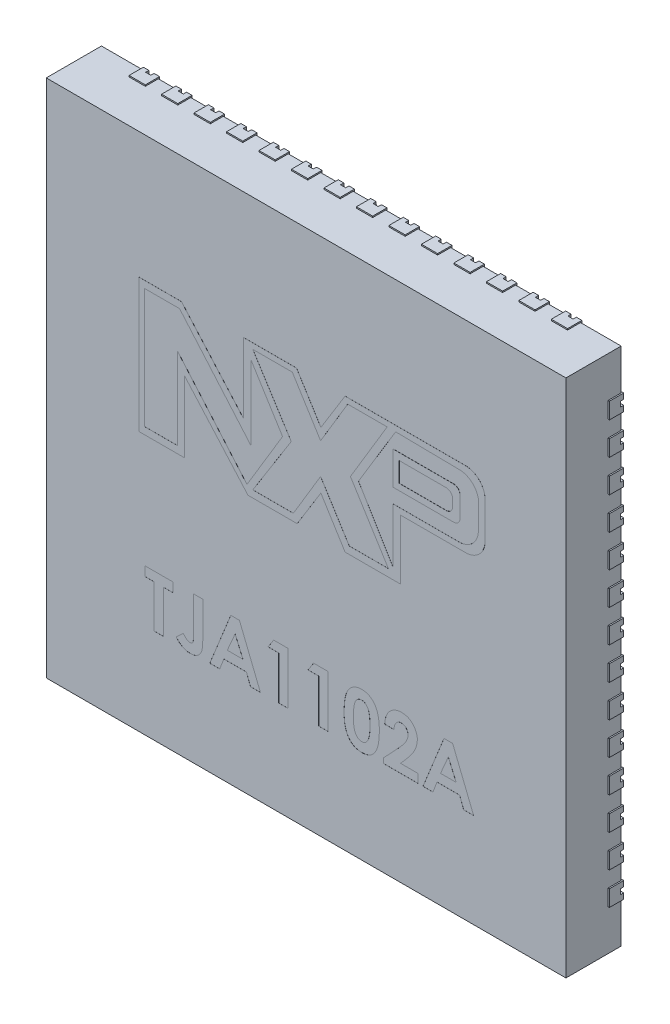
from build123d import *

# Parameters (mm, degrees)
SKETCH1_W            = 8
SKETCH1_H            = 8
BOSS_EXTRUDE1_DEPTH  = 0.85
BOSS_EXTRUDE2_DEPTH  = 0.001
CUT_EXTRUDE3_DEPTH   = 0.001
BOSS_EXTRUDE3_DEPTH  = 0.002
SKETCH17_W           = 0.102885944
SKETCH17_H           = 0.053280221
BOSS_EXTRUDE7_DEPTH  = 0.01
SKETCH18_W           = 0.053280221
SKETCH18_H           = 0.097122664
BOSS_EXTRUDE8_DEPTH  = 0.01
BOSS_EXTRUDE11_DEPTH = 0.02
BOSS_EXTRUDE12_DEPTH = 0.02
SKETCH20_W           = 11.066170871
SKETCH20_H           = 10.53323913
SKETCH20_W_2         = 8
SKETCH20_H_2         = 8
CUT_EXTRUDE5_DEPTH   = 60.02
SKETCH21_W           = 0.25
SKETCH21_H           = 0.22
BOSS_EXTRUDE13_DEPTH = 0.02
SKETCH22_W           = 0.22
SKETCH22_H           = 0.25
BOSS_EXTRUDE14_DEPTH = 0.02
CUT_EXTRUDE6_DEPTH   = 30.02
CUT_EXTRUDE7_DEPTH   = 0.05


with BuildPart() as part:
    # Sketch1 → Boss-Extrude1 (new body)
    with BuildSketch(Plane.XY):
        Rectangle(SKETCH1_W, SKETCH1_H)
    extrude(amount=BOSS_EXTRUDE1_DEPTH)

    # Sketch6 → Boss-Extrude2 (add)
    # profile 1 of 2: a face of its own
    with BuildSketch(Plane.XY.offset(0.85)):
        with BuildLine():
            Line((-2.572181988, 2.05829911), (-2.572181988, 0))
            Line((-2.572181988, 0), (-1.873722746, 0))
            Line((-1.873722746, 0), (-1.873722746, 1.098138196))
            Line((-1.873722746, 1.098138196), (-0.893404452, -0.010470706))
            Line((-0.893404452, -0.010470706), (-0.136448746, -0.010470706))
            Line((-0.136448746, -0.010470706), (0.228352899, 0.580170445))
            Line((0.228352899, 0.580170445), (0.601301061, -0.02108393))
            Line((0.601301061, -0.02108393), (1.455438192, -0.02108393))
            Line((1.455438192, -0.02108393), (1.455438192, 0.898972256))
            Line((1.455438192, 0.898972256), (2.455877544, 0.898972256))
            ThreePointArc((2.455877544, 0.898972256), (2.668009579, 0.986840222), (2.755877544, 1.198972256))
            Line((2.755877544, 1.198972256), (2.755877544, 1.75829911))
            ThreePointArc((2.755877544, 1.75829911), (2.668009579, 1.970431144), (2.455877544, 2.05829911))
            Line((2.455877544, 2.05829911), (0.601301061, 2.05829911))
            Line((0.601301061, 2.05829911), (0.228352899, 1.454468139))
            Line((0.228352899, 1.454468139), (-0.146193482, 2.05829911))
            Line((-0.146193482, 2.05829911), (-0.961388027, 2.05829911))
            Line((-0.961388027, 2.05829911), (-0.961388027, 0.976628837))
            Line((-0.961388027, 0.976628837), (-1.917885089, 2.05829911))
            Line((-1.917885089, 2.05829911), (-2.572181988, 2.05829911))
        make_face()
        Polygon((-1.977820319, 0.108733586), (-2.48457273, 0.108733586), (-2.48457273, 1.950510846), (-1.946368831, 1.950510846), (-0.850193083, 0.677075779), (-0.850193083, 1.821787095), (-0.361090095, 1.03808165), (-0.90931464, 0.125763735), (-1.977820319, 1.367054288), align=None, mode=Mode.SUBTRACT)
        Polygon((-0.228028186, 1.03808165), (-0.819884632, 1.97186495), (-0.211226434, 1.97186495), (0.223964381, 1.275260469), (0.64158324, 1.97186495), (1.249142409, 1.97186495), (0.68349863, 1.028349151), (1.268436343, 0.092046687), (0.664861213, 0.092046687), (0.223964381, 0.797784718), (-0.195507956, 0.098088564), (-0.819884632, 0.098088564), align=None, mode=Mode.SUBTRACT)
        with BuildLine():
            Line((0.807662695, 1.028349151), (1.379139756, 1.97186495))
            Line((1.379139756, 1.97186495), (2.3627905, 1.958078515))
            ThreePointArc((2.3627905, 1.958078515), (2.573670302, 1.867246317), (2.658556778, 1.653903715))
            Line((2.658556778, 1.653903715), (2.653410242, 1.286702658))
            ThreePointArc((2.653410242, 1.286702658), (2.564080062, 1.077293625), (2.353439703, 0.990906918))
            Line((2.353439703, 0.990906918), (1.338814728, 0.990906918))
            Line((1.338814728, 0.990906918), (1.338814728, 0.147417795))
            Line((1.338814728, 0.147417795), (0.807662695, 1.028349151))
        make_face(mode=Mode.SUBTRACT)
    # profile 2 of 2: a face of its own
    with BuildSketch(Plane.XY.offset(0.85)):
        with BuildLine():
            Line((2.271489026, 1.723742839), (1.338814728, 1.723742839))
            Line((1.338814728, 1.723742839), (1.338814728, 1.214183628))
            Line((1.338814728, 1.214183628), (2.271489026, 1.214183628))
            ThreePointArc((2.271489026, 1.214183628), (2.342199704, 1.24347295), (2.371489026, 1.314183628))
            Line((2.371489026, 1.314183628), (2.371489026, 1.623742839))
            ThreePointArc((2.371489026, 1.623742839), (2.342199704, 1.694453517), (2.271489026, 1.723742839))
        make_face()
        with BuildLine():
            Line((1.434337958, 1.313216465), (1.434337958, 1.617059243))
            Line((1.434337958, 1.617059243), (2.158511115, 1.617059243))
            ThreePointArc((2.158511115, 1.617059243), (2.229221793, 1.587769921), (2.258511115, 1.517059243))
            Line((2.258511115, 1.517059243), (2.258511115, 1.413216465))
            ThreePointArc((2.258511115, 1.413216465), (2.229221793, 1.342505787), (2.158511115, 1.313216465))
            Line((2.158511115, 1.313216465), (1.434337958, 1.313216465))
        make_face(mode=Mode.SUBTRACT)
    extrude(amount=BOSS_EXTRUDE2_DEPTH)

    # Sketch8 → Cut-Extrude3 (cut)
    # profile 1 of 8: a face of its own
    with BuildSketch(Plane.XY.offset(0.85)):
        Polygon((-2.482523388, -1.744618851), (-2.051754157, -1.744618851), (-2.051754157, -1.888208594), (-2.1953439, -1.888208594), (-2.1953439, -2.544618851), (-2.338933644, -2.544618851), (-2.338933644, -1.888208594), (-2.482523388, -1.888208594), align=None)
    # profile 2 of 8: a face of its own
    with BuildSketch(Plane.XY.offset(0.85)):
        with BuildLine():
            Line((-1.733805439, -1.744618851), (-1.590215695, -1.744618851))
            Line((-1.590215695, -1.744618851), (-1.590215695, -2.275708594))
            add(Edge.make_bspline(
                [(-1.590215695, -2.275708594), (-1.59026834, -2.285859156), (-1.590369775, -2.305417283), (-1.591385321, -2.333573767), (-1.592758518, -2.35938906), (-1.594736055, -2.382821799), (-1.597673239, -2.40387085), (-1.600997239, -2.422588729), (-1.604664534, -2.439051705), (-1.610859495, -2.457476337), (-1.620476992, -2.477879521), (-1.63499007, -2.499917859), (-1.653063498, -2.519065419), (-1.673878116, -2.535697288), (-1.697609305, -2.548866583), (-1.723710351, -2.558385384), (-1.752097818, -2.564071982), (-1.771759709, -2.564771522), (-1.781882362, -2.565131671)],
                knots=[0, 0, 0, 0, 1.22248561, 2.355488409, 3.392943897, 4.335991845, 5.186735882, 5.951517034, 6.625683685, 7.215700098, 8.28923535, 9.333114649, 10.380102123, 11.447198135, 12.530158036, 13.633358744, 14.781567393, 16, 16, 16, 16], degree=3))
            add(Edge.make_bspline(
                [(-1.781882362, -2.565131671), (-1.792429245, -2.564805152), (-1.813231818, -2.564161128), (-1.843740933, -2.5586757), (-1.873064006, -2.549880908), (-1.901049336, -2.537164694), (-1.928080329, -2.521235919), (-1.953666399, -2.501477823), (-1.978341746, -2.478503192), (-1.992969442, -2.460873038), (-2.000472106, -2.451830389)],
                knots=[0, 0, 0, 0, 0.990984786, 1.954608977, 2.90473533, 3.862451285, 4.837525908, 5.848096122, 6.896271184, 8, 8, 8, 8], degree=3))
            Line((-2.000472106, -2.451830389), (-1.891818259, -2.35134962))
            add(Edge.make_bspline(
                [(-1.891818259, -2.35134962), (-1.886129267, -2.357782264), (-1.875483632, -2.369819471), (-1.859440974, -2.385516284), (-1.844969632, -2.398126861), (-1.831327947, -2.407222985), (-1.818454616, -2.413634736), (-1.80607266, -2.418253301), (-1.793796116, -2.420867671), (-1.785685857, -2.421320577), (-1.781722106, -2.421541928)],
                knots=[0, 0, 0, 0, 1.529509877, 2.862124173, 3.996688592, 4.944357383, 5.774364335, 6.554177287, 7.293378699, 8, 8, 8, 8], degree=3))
            add(Edge.make_bspline(
                [(-1.781722106, -2.421541928), (-1.777885635, -2.421341862), (-1.770509364, -2.420957201), (-1.760366709, -2.416681211), (-1.751815798, -2.409967725), (-1.746186383, -2.402249703), (-1.742598955, -2.394359806), (-1.740357463, -2.386733008), (-1.738230283, -2.377590545), (-1.736526034, -2.366936997), (-1.7352383, -2.354633405), (-1.734596458, -2.340829134), (-1.733815895, -2.325449586), (-1.733809048, -2.314705638), (-1.733805439, -2.309041928)],
                knots=[0, 0, 0, 0, 1.003927327, 1.930222208, 2.840933547, 3.835773585, 4.407906147, 5.114514582, 5.922289074, 6.876303333, 7.950072246, 9.174518422, 10.510537432, 12, 12, 12, 12], degree=3))
            Line((-1.733805439, -2.309041928), (-1.733805439, -1.744618851))
        make_face()
    # profile 3 of 8: a face of its own
    with BuildSketch(Plane.XY.offset(0.85)):
        Polygon((-1.159286208, -1.744618851), (-1.026113131, -1.744618851), (-0.703036208, -2.544618851), (-0.856401593, -2.544618851), (-0.91858108, -2.380516287), (-1.267138772, -2.380516287), (-1.329318259, -2.544618851), (-1.482523388, -2.544618851), align=None)
        Polygon((-1.092779798, -1.959202184), (-1.212651593, -2.236926543), (-0.972908003, -2.236926543), align=None, mode=Mode.SUBTRACT)
    # profile 4 of 8: a face of its own
    with BuildSketch(Plane.XY.offset(0.85)):
        Polygon((-0.499350311, -1.744618851), (-0.277395182, -1.744618851), (-0.277395182, -2.544618851), (-0.420984926, -2.544618851), (-0.420984926, -1.877952184), (-0.58508749, -1.877952184), align=None)
    # profile 5 of 8: a face of its own
    with BuildSketch(Plane.XY.offset(0.85)):
        Polygon((0.116034305, -1.744618851), (0.337989433, -1.744618851), (0.337989433, -2.544618851), (0.194399689, -2.544618851), (0.194399689, -1.877952184), (0.030297125, -1.877952184), align=None)
    # profile 6 of 8: a face of its own
    with BuildSketch(Plane.XY.offset(0.85)):
        with BuildLine():
            add(Edge.make_bspline(
                [(0.853534305, -1.72410603), (0.860484644, -1.72420921), (0.874150869, -1.724412089), (0.894278645, -1.726609433), (0.913667259, -1.729929008), (0.93239256, -1.734558657), (0.950319763, -1.740685832), (0.967579345, -1.748019956), (0.983965867, -1.756945718), (0.99968831, -1.767027825), (1.014740618, -1.778442199), (1.028761018, -1.791455175), (1.042005553, -1.805767324), (1.054187528, -1.821595019), (1.065576716, -1.838794291), (1.076135694, -1.857367868), (1.085783631, -1.877406654), (1.094628657, -1.898946811), (1.102537907, -1.922311217), (1.109199858, -1.947767871), (1.114913596, -1.975322587), (1.119736394, -2.005043953), (1.12338165, -2.036971476), (1.125838626, -2.071083945), (1.127524719, -2.107315595), (1.127662326, -2.132170209), (1.127733023, -2.144939364)],
                knots=[0, 0, 0, 0, 0.879237366, 1.728815576, 2.559023295, 3.367336655, 4.166867292, 4.954216142, 5.737608147, 6.525189134, 7.316157332, 8.124696809, 8.942788509, 9.781158001, 10.649253743, 11.551476218, 12.482711956, 13.461909668, 14.496590415, 15.601789533, 16.789733467, 18.056700938, 19.410929216, 20.8549011, 22.384193279, 24, 24, 24, 24], degree=3))
            add(Edge.make_bspline(
                [(1.127733023, -2.144939364), (1.127656619, -2.157868274), (1.127508169, -2.182988916), (1.125908718, -2.219551959), (1.123154387, -2.253912105), (1.119604408, -2.286065797), (1.114741907, -2.315996058), (1.109047243, -2.343780385), (1.102280134, -2.369408707), (1.094110356, -2.392823279), (1.085318869, -2.414401266), (1.075644541, -2.434400981), (1.065255994, -2.452876595), (1.054391509, -2.470106838), (1.042455456, -2.485583772), (1.030028797, -2.499833692), (1.016570451, -2.512313801), (1.002647068, -2.523667268), (0.987748577, -2.533478942), (0.972028623, -2.54206007), (0.955206947, -2.549020384), (0.937590178, -2.555074094), (0.918878036, -2.559420004), (0.899367854, -2.562868341), (0.878839366, -2.564774103), (0.864862745, -2.565010526), (0.857700971, -2.565131671)],
                knots=[0, 0, 0, 0, 1.643780988, 3.193836972, 4.651895693, 6.025988579, 7.305620092, 8.505800249, 9.631074763, 10.672816429, 11.65661981, 12.592235626, 13.49536222, 14.350718032, 15.179365177, 15.97804903, 16.751647189, 17.51006938, 18.259804725, 19.016521909, 19.783502495, 20.571750527, 21.382245291, 22.22305063, 23.089471752, 24, 24, 24, 24], degree=3))
            add(Edge.make_bspline(
                [(0.857700971, -2.565131671), (0.850539391, -2.565008189), (0.836509961, -2.564766289), (0.815925962, -2.562882511), (0.796312386, -2.559406035), (0.777452201, -2.555040729), (0.759476671, -2.549033779), (0.742299604, -2.541865217), (0.726053077, -2.533337631), (0.710692105, -2.523503096), (0.696269136, -2.512225593), (0.682560036, -2.499625745), (0.669595131, -2.485735491), (0.657571649, -2.470399247), (0.646292681, -2.453821722), (0.635875848, -2.435813607), (0.62632741, -2.416401122), (0.61734869, -2.395557209), (0.60954732, -2.37283312), (0.602604462, -2.348025934), (0.596917056, -2.320928862), (0.592342863, -2.291550609), (0.58869083, -2.259953414), (0.585974138, -2.226122026), (0.584365803, -2.190040688), (0.584218909, -2.165240187), (0.584143279, -2.152471415)],
                knots=[0, 0, 0, 0, 0.917216111, 1.796812873, 2.643793957, 3.46689424, 4.273913431, 5.068098542, 5.848489301, 6.620921603, 7.401012384, 8.190319798, 9.003608147, 9.831726257, 10.68377682, 11.569763213, 12.493818149, 13.453288342, 14.474581811, 15.568529029, 16.750744269, 18.018426408, 19.375425659, 20.823733699, 22.36466933, 24, 24, 24, 24], degree=3))
            add(Edge.make_bspline(
                [(0.584143279, -2.152471415), (0.584280275, -2.134730211), (0.584544611, -2.100498331), (0.587894467, -2.051043216), (0.592811206, -2.005330529), (0.600032731, -1.963436737), (0.608962047, -1.925206676), (0.620396501, -1.890892186), (0.633413795, -1.86001845), (0.644506202, -1.841728663), (0.649848407, -1.832920133)],
                knots=[0, 0, 0, 0, 1.288568992, 2.486310467, 3.599230591, 4.627010532, 5.572937695, 6.447898582, 7.252493626, 8, 8, 8, 8], degree=3))
            add(Edge.make_bspline(
                [(0.649848407, -1.832920133), (0.656060069, -1.824266635), (0.668205093, -1.807347343), (0.689441006, -1.785135474), (0.71225623, -1.766138796), (0.737119376, -1.750787221), (0.763637223, -1.738680968), (0.792037441, -1.730130457), (0.822215152, -1.725148531), (0.84293869, -1.72445872), (0.853534305, -1.72410603)],
                knots=[0, 0, 0, 0, 1.058512271, 2.069600068, 3.047294572, 4.004278952, 4.967380941, 5.939006123, 6.946246673, 8, 8, 8, 8], degree=3))
        make_face()
        with BuildLine():
            add(Edge.make_bspline(
                [(0.857059946, -1.867695774), (0.850776781, -1.867993583), (0.838458443, -1.868577448), (0.820583948, -1.873533636), (0.803729415, -1.881188735), (0.790908622, -1.89040045), (0.781312386, -1.899230984), (0.774607427, -1.907222329), (0.768141551, -1.916140095), (0.762430563, -1.926386694), (0.7570379, -1.937593954), (0.751767643, -1.949812748), (0.747447416, -1.963343198), (0.743202908, -1.977954877), (0.739484322, -1.99405176), (0.736368963, -2.011765421), (0.733585663, -2.031211053), (0.731644278, -2.052401394), (0.729834325, -2.075314273), (0.728536865, -2.100000732), (0.727994429, -2.126454109), (0.727822006, -2.144672158), (0.727733023, -2.154073979)],
                knots=[0, 0, 0, 0, 1.076674018, 2.110852608, 3.161083442, 4.239746716, 4.804137807, 5.395870207, 6.026861976, 6.692161227, 7.405688833, 8.16177676, 8.973626916, 9.841385931, 10.773283133, 11.807421078, 12.927755683, 14.143907515, 15.458935494, 16.872852025, 18.386167141, 20, 20, 20, 20], degree=3))
            add(Edge.make_bspline(
                [(0.727733023, -2.154073979), (0.727879478, -2.166254493), (0.728160317, -2.18961153), (0.729631219, -2.223199764), (0.732579522, -2.253767762), (0.736246615, -2.281522693), (0.741397196, -2.306284561), (0.747323274, -2.328287635), (0.754641452, -2.347251429), (0.763099018, -2.363450203), (0.772466153, -2.377230466), (0.78263459, -2.388943752), (0.793258131, -2.399086905), (0.80466837, -2.407326064), (0.816838086, -2.413640175), (0.829665684, -2.418181837), (0.843159317, -2.420961977), (0.852399617, -2.421347493), (0.857059946, -2.421541928)],
                knots=[0, 0, 0, 0, 1.771748488, 3.397459088, 4.888034009, 6.237357457, 7.467047327, 8.564189669, 9.548206622, 10.417051504, 11.216568818, 11.965764335, 12.669334354, 13.348544111, 14.005342236, 14.656555988, 15.322436492, 16, 16, 16, 16], degree=3))
            add(Edge.make_bspline(
                [(0.857059946, -2.421541928), (0.861560347, -2.421408881), (0.870371572, -2.421148393), (0.883220311, -2.418474515), (0.895370992, -2.41412737), (0.906786928, -2.407978029), (0.917508952, -2.400158201), (0.927484662, -2.390633521), (0.936638822, -2.379309053), (0.941972077, -2.370904622), (0.944720202, -2.366573979)],
                knots=[0, 0, 0, 0, 0.992283464, 1.942767638, 2.88273346, 3.832339453, 4.79467288, 5.803907806, 6.868395428, 8, 8, 8, 8], degree=3))
            add(Edge.make_bspline(
                [(0.944720202, -2.366573979), (0.947955657, -2.360656293), (0.954740142, -2.348247386), (0.962591161, -2.327307818), (0.96919971, -2.303691446), (0.974887592, -2.277324774), (0.978777757, -2.248103808), (0.982127962, -2.216213842), (0.983743849, -2.181494289), (0.984006681, -2.157440457), (0.984143279, -2.144939364)],
                knots=[0, 0, 0, 0, 0.710965849, 1.490837728, 2.352621235, 3.297892224, 4.334225155, 5.461620853, 6.680770821, 8, 8, 8, 8], degree=3))
            add(Edge.make_bspline(
                [(0.984143279, -2.144939364), (0.984090514, -2.132329754), (0.983988951, -2.108058408), (0.982125562, -2.073214036), (0.979530651, -2.041389486), (0.975735044, -2.012655807), (0.970851306, -1.986943248), (0.964832081, -1.96425349), (0.957735863, -1.944541815), (0.949320593, -1.927827878), (0.940000159, -1.913623325), (0.930106234, -1.90143692), (0.919596982, -1.891032475), (0.908489978, -1.882370836), (0.896528147, -1.875752694), (0.883939975, -1.871079739), (0.870699655, -1.868252757), (0.861667883, -1.867883941), (0.857059946, -1.867695774)],
                knots=[0, 0, 0, 0, 1.793836731, 3.452829483, 4.963243077, 6.335886805, 7.574563692, 8.684454726, 9.672768357, 10.54971625, 11.340229787, 12.085688095, 12.778991901, 13.440269426, 14.083255152, 14.715733572, 15.344777694, 16, 16, 16, 16], degree=3))
        make_face(mode=Mode.SUBTRACT)
    # profile 7 of 8: a face of its own
    with BuildSketch(Plane.XY.offset(0.85)):
        with BuildLine():
            Line((1.353374048, -2.011285517), (1.209784305, -2.011285517))
            add(Edge.make_bspline(
                [(1.209784305, -2.011285517), (1.210404447, -2.000423713), (1.211616167, -1.979200399), (1.216436085, -1.948372856), (1.222894609, -1.919244218), (1.231514366, -1.89191638), (1.242345656, -1.866399272), (1.25510976, -1.842605905), (1.270132773, -1.820661551), (1.287094956, -1.800672038), (1.305708337, -1.782739262), (1.325586484, -1.766838937), (1.347033461, -1.753718388), (1.369657413, -1.742921391), (1.393454489, -1.734295092), (1.418649845, -1.728527713), (1.445025327, -1.724621988), (1.463081481, -1.724280221), (1.472284305, -1.72410603)],
                knots=[0, 0, 0, 0, 1.199038563, 2.342849363, 3.436047546, 4.486744587, 5.497670872, 6.488682221, 7.459191391, 8.424610317, 9.374430501, 10.305433194, 11.225809216, 12.140057399, 13.06607119, 14.010487599, 14.985989317, 16, 16, 16, 16], degree=3))
            add(Edge.make_bspline(
                [(1.472284305, -1.72410603), (1.483580641, -1.724458506), (1.505633736, -1.72514662), (1.537678632, -1.731016467), (1.567605061, -1.740834693), (1.59539127, -1.754553344), (1.620800709, -1.771981451), (1.643829166, -1.792761617), (1.663780222, -1.817329821), (1.680780373, -1.844663818), (1.694905467, -1.873606675), (1.704803745, -1.903534789), (1.711309776, -1.933653989), (1.712003685, -1.953934734), (1.712348407, -1.964009876)],
                knots=[0, 0, 0, 0, 1.075374347, 2.099382735, 3.09057751, 4.06680945, 5.040638231, 6.016817125, 7.011024321, 8.044445721, 9.0776792, 10.070479129, 11.0414456, 12, 12, 12, 12], degree=3))
            add(Edge.make_bspline(
                [(1.712348407, -1.964009876), (1.712214191, -1.970104035), (1.711944046, -1.98237007), (1.710065691, -2.000931591), (1.707247788, -2.019838671), (1.702999077, -2.039075098), (1.697700587, -2.058646264), (1.691272752, -2.07861074), (1.683566472, -2.098855334), (1.674710351, -2.119607895), (1.664144976, -2.140935799), (1.651843065, -2.16315876), (1.637478097, -2.186257063), (1.621223585, -2.21036113), (1.603000582, -2.235432944), (1.582720131, -2.261396983), (1.560615814, -2.288344733), (1.544927759, -2.306357792), (1.536867638, -2.31561244)],
                knots=[0, 0, 0, 0, 0.728284026, 1.46585585, 2.227944881, 3.01186502, 3.81876927, 4.650621989, 5.517437689, 6.406905708, 7.346299482, 8.360816762, 9.441613733, 10.596154504, 11.834900912, 13.145207542, 14.533280747, 16, 16, 16, 16], degree=3))
            Line((1.536867638, -2.31561244), (1.453374048, -2.411285517))
            Line((1.453374048, -2.411285517), (1.722604818, -2.411285517))
            Line((1.722604818, -2.411285517), (1.722604818, -2.544618851))
            Line((1.722604818, -2.544618851), (1.189271484, -2.544618851))
            Line((1.189271484, -2.544618851), (1.189271484, -2.47186244))
            Line((1.189271484, -2.47186244), (1.426130459, -2.219779107))
            add(Edge.make_bspline(
                [(1.426130459, -2.219779107), (1.432988135, -2.212425758), (1.446269419, -2.198184501), (1.465167319, -2.177269701), (1.482268248, -2.157422055), (1.497217606, -2.138430225), (1.510799916, -2.12091023), (1.522409543, -2.104333994), (1.532152707, -2.088851374), (1.542730293, -2.070182037), (1.552775523, -2.047915531), (1.561992629, -2.022263604), (1.567611093, -1.997746269), (1.568386619, -1.981770246), (1.568758664, -1.97410603)],
                knots=[0, 0, 0, 0, 1.246127091, 2.413378631, 3.493388633, 4.492180848, 5.408488754, 6.240484944, 6.999099869, 7.674939598, 8.898438119, 10.020720584, 11.050475521, 12, 12, 12, 12], degree=3))
            add(Edge.make_bspline(
                [(1.568758664, -1.97410603), (1.568480495, -1.966691493), (1.567941498, -1.952324638), (1.562018359, -1.931887863), (1.552842026, -1.913384449), (1.539911278, -1.8973673), (1.524248092, -1.884204947), (1.506147809, -1.874415158), (1.485758, -1.868766495), (1.471464355, -1.868059484), (1.464111228, -1.867695774)],
                knots=[0, 0, 0, 0, 1.062038974, 2.057870785, 3.028805853, 4.01125022, 4.991535629, 5.949134679, 6.94496649, 8, 8, 8, 8], degree=3))
            add(Edge.make_bspline(
                [(1.464111228, -1.867695774), (1.460312508, -1.867830133), (1.452834119, -1.868094639), (1.441841472, -1.86985539), (1.431381179, -1.87295853), (1.42133681, -1.8771163), (1.411815562, -1.882627455), (1.40284145, -1.88942083), (1.394319921, -1.897323793), (1.386290059, -1.90631163), (1.378981836, -1.916342058), (1.372490698, -1.927323471), (1.367123609, -1.939249052), (1.362398228, -1.951961365), (1.358753788, -1.96559695), (1.356100183, -1.9800742), (1.354082825, -1.995369562), (1.353614605, -2.005883686), (1.353374048, -2.011285517)],
                knots=[0, 0, 0, 0, 0.903469896, 1.778625579, 2.63899355, 3.493148037, 4.358286772, 5.247621495, 6.164656832, 7.118446693, 8.109501108, 9.111810964, 10.146451449, 11.215617525, 12.33435995, 13.498009769, 14.714554818, 16, 16, 16, 16], degree=3))
        make_face()
    # profile 8 of 8: a face of its own
    with BuildSketch(Plane.XY.offset(0.85)):
        Polygon((2.122765074, -1.744618851), (2.255938151, -1.744618851), (2.579015074, -2.544618851), (2.425649689, -2.544618851), (2.363470202, -2.380516287), (2.01491251, -2.380516287), (1.952733023, -2.544618851), (1.799527894, -2.544618851), align=None)
        Polygon((2.189271484, -1.959202184), (2.069399689, -2.236926543), (2.309143279, -2.236926543), align=None, mode=Mode.SUBTRACT)
    extrude(amount=-CUT_EXTRUDE3_DEPTH, mode=Mode.SUBTRACT)

    # Sketch10 → Boss-Extrude3 (add)
    with BuildSketch(Plane.XY.offset(0.85)):
        with BuildLine():
            Line((1.338814728, 1.723742839), (2.271489026, 1.723742839))
            ThreePointArc((2.271489026, 1.723742839), (2.342199704, 1.694453517), (2.371489026, 1.623742839))
            Line((2.371489026, 1.623742839), (2.371489026, 1.314183628))
            ThreePointArc((2.371489026, 1.314183628), (2.342199704, 1.24347295), (2.271489026, 1.214183628))
            Line((2.271489026, 1.214183628), (1.338814728, 1.214183628))
            Line((1.338814728, 1.214183628), (1.338814728, 1.723742839))
        make_face()
        with BuildLine():
            Line((2.258511115, 1.517059243), (2.258511115, 1.413216465))
            ThreePointArc((2.258511115, 1.413216465), (2.229221793, 1.342505787), (2.158511115, 1.313216465))
            Line((2.158511115, 1.313216465), (1.434337958, 1.313216465))
            Line((1.434337958, 1.313216465), (1.434337958, 1.617059243))
            Line((1.434337958, 1.617059243), (2.158511115, 1.617059243))
            ThreePointArc((2.158511115, 1.617059243), (2.229221793, 1.587769921), (2.258511115, 1.517059243))
        make_face(mode=Mode.SUBTRACT)
    extrude(amount=BOSS_EXTRUDE3_DEPTH)

    # Sketch17 → Boss-Extrude7 (add)
    with BuildSketch(Plane(origin=(0, 4, 0), x_dir=(1, 0, 0), z_dir=(0, 1, 0))):
        with Locations((-2.82646638, -0.10888348)):
            Rectangle(SKETCH17_W, SKETCH17_H)
        with Locations((2.82646638, -0.10888348)):
            Rectangle(SKETCH17_W, SKETCH17_H)
    boss_extrude7 = extrude(amount=BOSS_EXTRUDE7_DEPTH)

    # Mirror3: Boss-Extrude7 across plane
    add(boss_extrude7.mirror(Plane.ZX))

    # Sketch18 → Boss-Extrude8 (add)
    with BuildSketch(Plane.ZY.offset(4)):
        with Locations((0.10888348, -2.743920985)):
            Rectangle(SKETCH18_W, SKETCH18_H)
        with Locations((0.10888348, 2.743920985)):
            Rectangle(SKETCH18_W, SKETCH18_H)
    boss_extrude8 = extrude(amount=BOSS_EXTRUDE8_DEPTH)

    # Mirror4: Boss-Extrude8 across plane
    add(boss_extrude8.mirror(Plane(origin=(0, 0, 0), x_dir=(0, 0, 1), z_dir=(1, 0, 0))))

    # Sketch4 → Boss-Extrude11 (add)
    with BuildSketch(Plane(origin=(0, 0, 0), x_dir=(-1, 0, 0), z_dir=(0, 0, -1))):
        with BuildLine():
            Line((2.5, 2.25), (2.5, 2.135410197))
            ThreePointArc((2.5, 2.135410197), (2.480178373, 2.075648766), (2.428571429, 2.039578712))
            ThreePointArc((2.428571429, 2.039578712), (2.25, 1.8), (2.428571429, 1.560421288))
            ThreePointArc((2.428571429, 1.560421288), (2.480178373, 1.524351234), (2.5, 1.464589803))
            Line((2.5, 1.464589803), (2.5, -2.25))
            ThreePointArc((2.5, -2.25), (2.426776695, -2.426776695), (2.25, -2.5))
            Line((2.25, -2.5), (-2.25, -2.5))
            ThreePointArc((-2.25, -2.5), (-2.426776695, -2.426776695), (-2.5, -2.25))
            Line((-2.5, -2.25), (-2.5, 2.25))
            ThreePointArc((-2.5, 2.25), (-2.426776695, 2.426776695), (-2.25, 2.5))
            Line((-2.25, 2.5), (2.25, 2.5))
            ThreePointArc((2.25, 2.5), (2.426776695, 2.426776695), (2.5, 2.25))
        make_face()
    extrude(amount=BOSS_EXTRUDE11_DEPTH)

    # Sketch19 → Boss-Extrude12 (add)
    with BuildSketch(Plane(origin=(0, 0, 0), x_dir=(-1, 0, 0), z_dir=(0, 0, -1))):
        with BuildLine():
            Line((-3.125, 4.375), (-3.125, 3.625))
            ThreePointArc((-3.125, 3.625), (-3.25, 3.5), (-3.375, 3.625))
            Line((-3.375, 3.625), (-3.375, 4.375))
            ThreePointArc((-3.375, 4.375), (-3.25, 4.5), (-3.125, 4.375))
        make_face()
        with BuildLine():
            Line((-2.875, 4.375), (-2.875, 3.625))
            ThreePointArc((-2.875, 3.625), (-2.75, 3.5), (-2.625, 3.625))
            Line((-2.625, 3.625), (-2.625, 4.375))
            ThreePointArc((-2.625, 4.375), (-2.75, 4.5), (-2.875, 4.375))
        make_face()
        with BuildLine():
            Line((-2.375, 4.375), (-2.375, 3.625))
            ThreePointArc((-2.375, 3.625), (-2.25, 3.5), (-2.125, 3.625))
            Line((-2.125, 3.625), (-2.125, 4.375))
            ThreePointArc((-2.125, 4.375), (-2.25, 4.5), (-2.375, 4.375))
        make_face()
        with BuildLine():
            Line((-1.875, 4.375), (-1.875, 3.625))
            ThreePointArc((-1.875, 3.625), (-1.75, 3.5), (-1.625, 3.625))
            Line((-1.625, 3.625), (-1.625, 4.375))
            ThreePointArc((-1.625, 4.375), (-1.75, 4.5), (-1.875, 4.375))
        make_face()
        with BuildLine():
            Line((-1.375, 4.375), (-1.375, 3.625))
            ThreePointArc((-1.375, 3.625), (-1.25, 3.5), (-1.125, 3.625))
            Line((-1.125, 3.625), (-1.125, 4.375))
            ThreePointArc((-1.125, 4.375), (-1.25, 4.5), (-1.375, 4.375))
        make_face()
        with BuildLine():
            Line((-0.875, 4.375), (-0.875, 3.625))
            ThreePointArc((-0.875, 3.625), (-0.75, 3.5), (-0.625, 3.625))
            Line((-0.625, 3.625), (-0.625, 4.375))
            ThreePointArc((-0.625, 4.375), (-0.75, 4.5), (-0.875, 4.375))
        make_face()
        with BuildLine():
            Line((-0.375, 4.375), (-0.375, 3.625))
            ThreePointArc((-0.375, 3.625), (-0.25, 3.5), (-0.125, 3.625))
            Line((-0.125, 3.625), (-0.125, 4.375))
            ThreePointArc((-0.125, 4.375), (-0.25, 4.5), (-0.375, 4.375))
        make_face()
        with BuildLine():
            Line((0.125, 4.375), (0.125, 3.625))
            ThreePointArc((0.125, 3.625), (0.25, 3.5), (0.375, 3.625))
            Line((0.375, 3.625), (0.375, 4.375))
            ThreePointArc((0.375, 4.375), (0.25, 4.5), (0.125, 4.375))
        make_face()
        with BuildLine():
            Line((0.625, 4.375), (0.625, 3.625))
            ThreePointArc((0.625, 3.625), (0.75, 3.5), (0.875, 3.625))
            Line((0.875, 3.625), (0.875, 4.375))
            ThreePointArc((0.875, 4.375), (0.75, 4.5), (0.625, 4.375))
        make_face()
        with BuildLine():
            Line((1.125, 4.375), (1.125, 3.625))
            ThreePointArc((1.125, 3.625), (1.25, 3.5), (1.375, 3.625))
            Line((1.375, 3.625), (1.375, 4.375))
            ThreePointArc((1.375, 4.375), (1.25, 4.5), (1.125, 4.375))
        make_face()
        with BuildLine():
            Line((1.625, 4.375), (1.625, 3.625))
            ThreePointArc((1.625, 3.625), (1.75, 3.5), (1.875, 3.625))
            Line((1.875, 3.625), (1.875, 4.375))
            ThreePointArc((1.875, 4.375), (1.75, 4.5), (1.625, 4.375))
        make_face()
        with BuildLine():
            Line((2.125, 4.375), (2.125, 3.625))
            ThreePointArc((2.125, 3.625), (2.25, 3.5), (2.375, 3.625))
            Line((2.375, 3.625), (2.375, 4.375))
            ThreePointArc((2.375, 4.375), (2.25, 4.5), (2.125, 4.375))
        make_face()
        with BuildLine():
            Line((2.625, 4.375), (2.625, 3.625))
            ThreePointArc((2.625, 3.625), (2.75, 3.5), (2.875, 3.625))
            Line((2.875, 3.625), (2.875, 4.375))
            ThreePointArc((2.875, 4.375), (2.75, 4.5), (2.625, 4.375))
        make_face()
        with BuildLine():
            Line((3.125, 4.375), (3.125, 3.625))
            ThreePointArc((3.125, 3.625), (3.25, 3.5), (3.375, 3.625))
            Line((3.375, 3.625), (3.375, 4.375))
            ThreePointArc((3.375, 4.375), (3.25, 4.5), (3.125, 4.375))
        make_face()
        with BuildLine():
            Line((-4.375, 3.125), (-3.625, 3.125))
            ThreePointArc((-3.625, 3.125), (-3.5, 3.25), (-3.625, 3.375))
            Line((-3.625, 3.375), (-4.375, 3.375))
            ThreePointArc((-4.375, 3.375), (-4.5, 3.25), (-4.375, 3.125))
        make_face()
        with BuildLine():
            Line((-4.375, 2.625), (-3.625, 2.625))
            ThreePointArc((-3.625, 2.625), (-3.5, 2.75), (-3.625, 2.875))
            Line((-3.625, 2.875), (-4.375, 2.875))
            ThreePointArc((-4.375, 2.875), (-4.5, 2.75), (-4.375, 2.625))
        make_face()
        with BuildLine():
            Line((-4.375, 2.125), (-3.625, 2.125))
            ThreePointArc((-3.625, 2.125), (-3.5, 2.25), (-3.625, 2.375))
            Line((-3.625, 2.375), (-4.375, 2.375))
            ThreePointArc((-4.375, 2.375), (-4.5, 2.25), (-4.375, 2.125))
        make_face()
        with BuildLine():
            Line((-4.375, 1.625), (-3.625, 1.625))
            ThreePointArc((-3.625, 1.625), (-3.5, 1.75), (-3.625, 1.875))
            Line((-3.625, 1.875), (-4.375, 1.875))
            ThreePointArc((-4.375, 1.875), (-4.5, 1.75), (-4.375, 1.625))
        make_face()
        with BuildLine():
            Line((-4.375, 1.125), (-3.625, 1.125))
            ThreePointArc((-3.625, 1.125), (-3.5, 1.25), (-3.625, 1.375))
            Line((-3.625, 1.375), (-4.375, 1.375))
            ThreePointArc((-4.375, 1.375), (-4.5, 1.25), (-4.375, 1.125))
        make_face()
        with BuildLine():
            Line((-4.375, 0.625), (-3.625, 0.625))
            ThreePointArc((-3.625, 0.625), (-3.5, 0.75), (-3.625, 0.875))
            Line((-3.625, 0.875), (-4.375, 0.875))
            ThreePointArc((-4.375, 0.875), (-4.5, 0.75), (-4.375, 0.625))
        make_face()
        with BuildLine():
            Line((-4.375, 0.125), (-3.625, 0.125))
            ThreePointArc((-3.625, 0.125), (-3.5, 0.25), (-3.625, 0.375))
            Line((-3.625, 0.375), (-4.375, 0.375))
            ThreePointArc((-4.375, 0.375), (-4.5, 0.25), (-4.375, 0.125))
        make_face()
        with BuildLine():
            Line((-4.375, -0.375), (-3.625, -0.375))
            ThreePointArc((-3.625, -0.375), (-3.5, -0.25), (-3.625, -0.125))
            Line((-3.625, -0.125), (-4.375, -0.125))
            ThreePointArc((-4.375, -0.125), (-4.5, -0.25), (-4.375, -0.375))
        make_face()
        with BuildLine():
            Line((-4.375, -0.875), (-3.625, -0.875))
            ThreePointArc((-3.625, -0.875), (-3.5, -0.75), (-3.625, -0.625))
            Line((-3.625, -0.625), (-4.375, -0.625))
            ThreePointArc((-4.375, -0.625), (-4.5, -0.75), (-4.375, -0.875))
        make_face()
        with BuildLine():
            Line((-4.375, -1.375), (-3.625, -1.375))
            ThreePointArc((-3.625, -1.375), (-3.5, -1.25), (-3.625, -1.125))
            Line((-3.625, -1.125), (-4.375, -1.125))
            ThreePointArc((-4.375, -1.125), (-4.5, -1.25), (-4.375, -1.375))
        make_face()
        with BuildLine():
            Line((-4.375, -1.875), (-3.625, -1.875))
            ThreePointArc((-3.625, -1.875), (-3.5, -1.75), (-3.625, -1.625))
            Line((-3.625, -1.625), (-4.375, -1.625))
            ThreePointArc((-4.375, -1.625), (-4.5, -1.75), (-4.375, -1.875))
        make_face()
        with BuildLine():
            Line((-4.375, -2.375), (-3.625, -2.375))
            ThreePointArc((-3.625, -2.375), (-3.5, -2.25), (-3.625, -2.125))
            Line((-3.625, -2.125), (-4.375, -2.125))
            ThreePointArc((-4.375, -2.125), (-4.5, -2.25), (-4.375, -2.375))
        make_face()
        with BuildLine():
            Line((-4.375, -2.875), (-3.625, -2.875))
            ThreePointArc((-3.625, -2.875), (-3.5, -2.75), (-3.625, -2.625))
            Line((-3.625, -2.625), (-4.375, -2.625))
            ThreePointArc((-4.375, -2.625), (-4.5, -2.75), (-4.375, -2.875))
        make_face()
        with BuildLine():
            Line((-4.375, -3.375), (-3.625, -3.375))
            ThreePointArc((-3.625, -3.375), (-3.5, -3.25), (-3.625, -3.125))
            Line((-3.625, -3.125), (-4.375, -3.125))
            ThreePointArc((-4.375, -3.125), (-4.5, -3.25), (-4.375, -3.375))
        make_face()
        with BuildLine():
            Line((4.375, 3.125), (3.625, 3.125))
            ThreePointArc((3.625, 3.125), (3.5, 3.25), (3.625, 3.375))
            Line((3.625, 3.375), (4.375, 3.375))
            ThreePointArc((4.375, 3.375), (4.5, 3.25), (4.375, 3.125))
        make_face()
        with BuildLine():
            Line((4.375, 2.625), (3.625, 2.625))
            ThreePointArc((3.625, 2.625), (3.5, 2.75), (3.625, 2.875))
            Line((3.625, 2.875), (4.375, 2.875))
            ThreePointArc((4.375, 2.875), (4.5, 2.75), (4.375, 2.625))
        make_face()
        with BuildLine():
            Line((4.375, 2.125), (3.625, 2.125))
            ThreePointArc((3.625, 2.125), (3.5, 2.25), (3.625, 2.375))
            Line((3.625, 2.375), (4.375, 2.375))
            ThreePointArc((4.375, 2.375), (4.5, 2.25), (4.375, 2.125))
        make_face()
        with BuildLine():
            Line((4.375, 1.625), (3.625, 1.625))
            ThreePointArc((3.625, 1.625), (3.5, 1.75), (3.625, 1.875))
            Line((3.625, 1.875), (4.375, 1.875))
            ThreePointArc((4.375, 1.875), (4.5, 1.75), (4.375, 1.625))
        make_face()
        with BuildLine():
            Line((4.375, 1.125), (3.625, 1.125))
            ThreePointArc((3.625, 1.125), (3.5, 1.25), (3.625, 1.375))
            Line((3.625, 1.375), (4.375, 1.375))
            ThreePointArc((4.375, 1.375), (4.5, 1.25), (4.375, 1.125))
        make_face()
        with BuildLine():
            Line((4.375, 0.625), (3.625, 0.625))
            ThreePointArc((3.625, 0.625), (3.5, 0.75), (3.625, 0.875))
            Line((3.625, 0.875), (4.375, 0.875))
            ThreePointArc((4.375, 0.875), (4.5, 0.75), (4.375, 0.625))
        make_face()
        with BuildLine():
            Line((4.375, 0.125), (3.625, 0.125))
            ThreePointArc((3.625, 0.125), (3.5, 0.25), (3.625, 0.375))
            Line((3.625, 0.375), (4.375, 0.375))
            ThreePointArc((4.375, 0.375), (4.5, 0.25), (4.375, 0.125))
        make_face()
        with BuildLine():
            Line((4.375, -0.375), (3.625, -0.375))
            ThreePointArc((3.625, -0.375), (3.5, -0.25), (3.625, -0.125))
            Line((3.625, -0.125), (4.375, -0.125))
            ThreePointArc((4.375, -0.125), (4.5, -0.25), (4.375, -0.375))
        make_face()
        with BuildLine():
            Line((4.375, -0.875), (3.625, -0.875))
            ThreePointArc((3.625, -0.875), (3.5, -0.75), (3.625, -0.625))
            Line((3.625, -0.625), (4.375, -0.625))
            ThreePointArc((4.375, -0.625), (4.5, -0.75), (4.375, -0.875))
        make_face()
        with BuildLine():
            Line((4.375, -1.375), (3.625, -1.375))
            ThreePointArc((3.625, -1.375), (3.5, -1.25), (3.625, -1.125))
            Line((3.625, -1.125), (4.375, -1.125))
            ThreePointArc((4.375, -1.125), (4.5, -1.25), (4.375, -1.375))
        make_face()
        with BuildLine():
            Line((4.375, -1.875), (3.625, -1.875))
            ThreePointArc((3.625, -1.875), (3.5, -1.75), (3.625, -1.625))
            Line((3.625, -1.625), (4.375, -1.625))
            ThreePointArc((4.375, -1.625), (4.5, -1.75), (4.375, -1.875))
        make_face()
        with BuildLine():
            Line((4.375, -2.375), (3.625, -2.375))
            ThreePointArc((3.625, -2.375), (3.5, -2.25), (3.625, -2.125))
            Line((3.625, -2.125), (4.375, -2.125))
            ThreePointArc((4.375, -2.125), (4.5, -2.25), (4.375, -2.375))
        make_face()
        with BuildLine():
            Line((4.375, -2.875), (3.625, -2.875))
            ThreePointArc((3.625, -2.875), (3.5, -2.75), (3.625, -2.625))
            Line((3.625, -2.625), (4.375, -2.625))
            ThreePointArc((4.375, -2.625), (4.5, -2.75), (4.375, -2.875))
        make_face()
        with BuildLine():
            Line((4.375, -3.375), (3.625, -3.375))
            ThreePointArc((3.625, -3.375), (3.5, -3.25), (3.625, -3.125))
            Line((3.625, -3.125), (4.375, -3.125))
            ThreePointArc((4.375, -3.125), (4.5, -3.25), (4.375, -3.375))
        make_face()
        with BuildLine():
            Line((-3.125, -4.375), (-3.125, -3.625))
            ThreePointArc((-3.125, -3.625), (-3.25, -3.5), (-3.375, -3.625))
            Line((-3.375, -3.625), (-3.375, -4.375))
            ThreePointArc((-3.375, -4.375), (-3.25, -4.5), (-3.125, -4.375))
        make_face()
        with BuildLine():
            Line((-2.625, -4.375), (-2.625, -3.625))
            ThreePointArc((-2.625, -3.625), (-2.75, -3.5), (-2.875, -3.625))
            Line((-2.875, -3.625), (-2.875, -4.375))
            ThreePointArc((-2.875, -4.375), (-2.75, -4.5), (-2.625, -4.375))
        make_face()
        with BuildLine():
            Line((-2.125, -4.375), (-2.125, -3.625))
            ThreePointArc((-2.125, -3.625), (-2.25, -3.5), (-2.375, -3.625))
            Line((-2.375, -3.625), (-2.375, -4.375))
            ThreePointArc((-2.375, -4.375), (-2.25, -4.5), (-2.125, -4.375))
        make_face()
        with BuildLine():
            Line((-1.625, -4.375), (-1.625, -3.625))
            ThreePointArc((-1.625, -3.625), (-1.75, -3.5), (-1.875, -3.625))
            Line((-1.875, -3.625), (-1.875, -4.375))
            ThreePointArc((-1.875, -4.375), (-1.75, -4.5), (-1.625, -4.375))
        make_face()
        with BuildLine():
            Line((-1.125, -4.375), (-1.125, -3.625))
            ThreePointArc((-1.125, -3.625), (-1.25, -3.5), (-1.375, -3.625))
            Line((-1.375, -3.625), (-1.375, -4.375))
            ThreePointArc((-1.375, -4.375), (-1.25, -4.5), (-1.125, -4.375))
        make_face()
        with BuildLine():
            Line((-0.625, -4.375), (-0.625, -3.625))
            ThreePointArc((-0.625, -3.625), (-0.75, -3.5), (-0.875, -3.625))
            Line((-0.875, -3.625), (-0.875, -4.375))
            ThreePointArc((-0.875, -4.375), (-0.75, -4.5), (-0.625, -4.375))
        make_face()
        with BuildLine():
            Line((-0.125, -4.375), (-0.125, -3.625))
            ThreePointArc((-0.125, -3.625), (-0.25, -3.5), (-0.375, -3.625))
            Line((-0.375, -3.625), (-0.375, -4.375))
            ThreePointArc((-0.375, -4.375), (-0.25, -4.5), (-0.125, -4.375))
        make_face()
        with BuildLine():
            Line((0.375, -4.375), (0.375, -3.625))
            ThreePointArc((0.375, -3.625), (0.25, -3.5), (0.125, -3.625))
            Line((0.125, -3.625), (0.125, -4.375))
            ThreePointArc((0.125, -4.375), (0.25, -4.5), (0.375, -4.375))
        make_face()
        with BuildLine():
            Line((0.875, -4.375), (0.875, -3.625))
            ThreePointArc((0.875, -3.625), (0.75, -3.5), (0.625, -3.625))
            Line((0.625, -3.625), (0.625, -4.375))
            ThreePointArc((0.625, -4.375), (0.75, -4.5), (0.875, -4.375))
        make_face()
        with BuildLine():
            Line((1.375, -4.375), (1.375, -3.625))
            ThreePointArc((1.375, -3.625), (1.25, -3.5), (1.125, -3.625))
            Line((1.125, -3.625), (1.125, -4.375))
            ThreePointArc((1.125, -4.375), (1.25, -4.5), (1.375, -4.375))
        make_face()
        with BuildLine():
            Line((1.875, -4.375), (1.875, -3.625))
            ThreePointArc((1.875, -3.625), (1.75, -3.5), (1.625, -3.625))
            Line((1.625, -3.625), (1.625, -4.375))
            ThreePointArc((1.625, -4.375), (1.75, -4.5), (1.875, -4.375))
        make_face()
        with BuildLine():
            Line((2.375, -4.375), (2.375, -3.625))
            ThreePointArc((2.375, -3.625), (2.25, -3.5), (2.125, -3.625))
            Line((2.125, -3.625), (2.125, -4.375))
            ThreePointArc((2.125, -4.375), (2.25, -4.5), (2.375, -4.375))
        make_face()
        with BuildLine():
            Line((2.875, -4.375), (2.875, -3.625))
            ThreePointArc((2.875, -3.625), (2.75, -3.5), (2.625, -3.625))
            Line((2.625, -3.625), (2.625, -4.375))
            ThreePointArc((2.625, -4.375), (2.75, -4.5), (2.875, -4.375))
        make_face()
        with BuildLine():
            Line((3.375, -4.375), (3.375, -3.625))
            ThreePointArc((3.375, -3.625), (3.25, -3.5), (3.125, -3.625))
            Line((3.125, -3.625), (3.125, -4.375))
            ThreePointArc((3.125, -4.375), (3.25, -4.5), (3.375, -4.375))
        make_face()
    extrude(amount=BOSS_EXTRUDE12_DEPTH)

    # Sketch20 → Cut-Extrude5 (cut)
    with BuildSketch(Plane.XY.offset(0.85)):
        with Locations((-0.327549065, 0.142146606)):
            Rectangle(SKETCH20_W, SKETCH20_H)
        Rectangle(SKETCH20_W_2, SKETCH20_H_2, mode=Mode.SUBTRACT)
    extrude(amount=-CUT_EXTRUDE5_DEPTH, mode=Mode.SUBTRACT)

    # Sketch21 → Boss-Extrude13 (add)
    with BuildSketch(Plane.XZ.offset(4)):
        with Locations((-3.25, 0.09)):
            Rectangle(SKETCH21_W, SKETCH21_H)
        with Locations((-2.75, 0.09)):
            Rectangle(SKETCH21_W, SKETCH21_H)
        with Locations((-2.25, 0.09)):
            Rectangle(SKETCH21_W, SKETCH21_H)
        with Locations((-1.75, 0.09)):
            Rectangle(SKETCH21_W, SKETCH21_H)
        with Locations((-1.25, 0.09)):
            Rectangle(SKETCH21_W, SKETCH21_H)
        with Locations((-0.75, 0.09)):
            Rectangle(SKETCH21_W, SKETCH21_H)
        with Locations((-0.25, 0.09)):
            Rectangle(SKETCH21_W, SKETCH21_H)
        with Locations((0.25, 0.09)):
            Rectangle(SKETCH21_W, SKETCH21_H)
        with Locations((0.75, 0.09)):
            Rectangle(SKETCH21_W, SKETCH21_H)
        with Locations((1.25, 0.09)):
            Rectangle(SKETCH21_W, SKETCH21_H)
        with Locations((1.75, 0.09)):
            Rectangle(SKETCH21_W, SKETCH21_H)
        with Locations((2.25, 0.09)):
            Rectangle(SKETCH21_W, SKETCH21_H)
        with Locations((2.75, 0.09)):
            Rectangle(SKETCH21_W, SKETCH21_H)
        with Locations((3.25, 0.09)):
            Rectangle(SKETCH21_W, SKETCH21_H)
    boss_extrude13 = extrude(amount=BOSS_EXTRUDE13_DEPTH)

    # Mirror5: Boss-Extrude13 across plane
    add(boss_extrude13.mirror(Plane.ZX))

    # Sketch22 → Boss-Extrude14 (add)
    with BuildSketch(Plane.ZY.offset(4)):
        with Locations((0.09, 3.25)):
            Rectangle(SKETCH22_W, SKETCH22_H)
        with Locations((0.09, 2.750006119)):
            Rectangle(SKETCH22_W, SKETCH22_H)
        with Locations((0.09, 2.250012238)):
            Rectangle(SKETCH22_W, SKETCH22_H)
        with Locations((0.09, 1.750018357)):
            Rectangle(SKETCH22_W, SKETCH22_H)
        with Locations((0.09, 1.250024476)):
            Rectangle(SKETCH22_W, SKETCH22_H)
        with Locations((0.09, 0.750030595)):
            Rectangle(SKETCH22_W, SKETCH22_H)
        with Locations((0.09, 0.250036714)):
            Rectangle(SKETCH22_W, SKETCH22_H)
        with Locations((0.09, -0.249957167)):
            Rectangle(SKETCH22_W, SKETCH22_H)
        with Locations((0.09, -0.749951048)):
            Rectangle(SKETCH22_W, SKETCH22_H)
        with Locations((0.09, -1.249944929)):
            Rectangle(SKETCH22_W, SKETCH22_H)
        with Locations((0.09, -1.74993881)):
            Rectangle(SKETCH22_W, SKETCH22_H)
        with Locations((0.09, -2.249932691)):
            Rectangle(SKETCH22_W, SKETCH22_H)
        with Locations((0.09, -2.749926572)):
            Rectangle(SKETCH22_W, SKETCH22_H)
        with Locations((0.09, -3.249920453)):
            Rectangle(SKETCH22_W, SKETCH22_H)
    boss_extrude14 = extrude(amount=BOSS_EXTRUDE14_DEPTH)

    # Mirror6: Boss-Extrude14 across plane
    add(boss_extrude14.mirror(Plane(origin=(0, 0, 0), x_dir=(0, 0, 1), z_dir=(1, 0, 0))))

    # Sketch23 → Cut-Extrude6 (cut)
    with BuildSketch(Plane(origin=(0, 0, 0), x_dir=(-1, 0, 0), z_dir=(0, 0, -1))):
        Polygon((-3.375, -3.726106622), (-3.174369428, -3.52547605), (-3.174369428, -3.402015219), (-3.375, -3.402015219), align=None)
        Polygon((-3.402015219, -3.174369428), (-3.402015219, -3.375), (-3.726106622, -3.375), (-3.52547605, -3.174369428), align=None)
        Polygon((3.52547605, -3.174369428), (3.402015219, -3.174369428), (3.402015219, -3.375), (3.726106622, -3.375), align=None)
        Polygon((3.174369428, -3.402015219), (3.375, -3.402015219), (3.375, -3.726106622), (3.174369428, -3.52547605), align=None)
        Polygon((3.174369428, 3.52547605), (3.174369428, 3.402015219), (3.375, 3.402015219), (3.375, 3.726106622), align=None)
        Polygon((3.726106622, 3.375), (3.52547605, 3.174369428), (3.402015219, 3.174369428), (3.402015219, 3.375), align=None)
        Polygon((-3.174369428, 3.402015219), (-3.375, 3.402015219), (-3.375, 3.726106622), (-3.174369428, 3.52547605), align=None)
        Polygon((-3.52547605, 3.174369428), (-3.402015219, 3.174369428), (-3.402015219, 3.375), (-3.726106622, 3.375), align=None)
    extrude(amount=CUT_EXTRUDE6_DEPTH, mode=Mode.SUBTRACT)

    # Sketch24 → Cut-Extrude7 (cut)
    with BuildSketch(Plane(origin=(0, 0, -0.02), x_dir=(-1, 0, 0), z_dir=(0, 0, -1))):
        with BuildLine():
            Line((-3.29, -4.06), (-3.29, -3.98))
            ThreePointArc((-3.29, -3.98), (-3.25, -3.94), (-3.21, -3.98))
            Line((-3.21, -3.98), (-3.21, -4.06))
            ThreePointArc((-3.21, -4.06), (-3.25, -4.1), (-3.29, -4.06))
        make_face()
        with BuildLine():
            Line((-2.71, -4.06), (-2.71, -3.98))
            ThreePointArc((-2.71, -3.98), (-2.75, -3.94), (-2.79, -3.98))
            Line((-2.79, -3.98), (-2.79, -4.06))
            ThreePointArc((-2.79, -4.06), (-2.75, -4.1), (-2.71, -4.06))
        make_face()
        with BuildLine():
            Line((-2.21, -4.06), (-2.21, -3.98))
            ThreePointArc((-2.21, -3.98), (-2.25, -3.94), (-2.29, -3.98))
            Line((-2.29, -3.98), (-2.29, -4.06))
            ThreePointArc((-2.29, -4.06), (-2.25, -4.1), (-2.21, -4.06))
        make_face()
        with BuildLine():
            Line((-1.71, -4.06), (-1.71, -3.98))
            ThreePointArc((-1.71, -3.98), (-1.75, -3.94), (-1.79, -3.98))
            Line((-1.79, -3.98), (-1.79, -4.06))
            ThreePointArc((-1.79, -4.06), (-1.75, -4.1), (-1.71, -4.06))
        make_face()
        with BuildLine():
            Line((-1.21, -4.06), (-1.21, -3.98))
            ThreePointArc((-1.21, -3.98), (-1.25, -3.94), (-1.29, -3.98))
            Line((-1.29, -3.98), (-1.29, -4.06))
            ThreePointArc((-1.29, -4.06), (-1.25, -4.1), (-1.21, -4.06))
        make_face()
        with BuildLine():
            Line((-0.71, -4.06), (-0.71, -3.98))
            ThreePointArc((-0.71, -3.98), (-0.75, -3.94), (-0.79, -3.98))
            Line((-0.79, -3.98), (-0.79, -4.06))
            ThreePointArc((-0.79, -4.06), (-0.75, -4.1), (-0.71, -4.06))
        make_face()
        with BuildLine():
            Line((-0.21, -4.06), (-0.21, -3.98))
            ThreePointArc((-0.21, -3.98), (-0.25, -3.94), (-0.29, -3.98))
            Line((-0.29, -3.98), (-0.29, -4.06))
            ThreePointArc((-0.29, -4.06), (-0.25, -4.1), (-0.21, -4.06))
        make_face()
        with BuildLine():
            Line((0.29, -4.06), (0.29, -3.98))
            ThreePointArc((0.29, -3.98), (0.25, -3.94), (0.21, -3.98))
            Line((0.21, -3.98), (0.21, -4.06))
            ThreePointArc((0.21, -4.06), (0.25, -4.1), (0.29, -4.06))
        make_face()
        with BuildLine():
            Line((0.79, -4.06), (0.79, -3.98))
            ThreePointArc((0.79, -3.98), (0.75, -3.94), (0.71, -3.98))
            Line((0.71, -3.98), (0.71, -4.06))
            ThreePointArc((0.71, -4.06), (0.75, -4.1), (0.79, -4.06))
        make_face()
        with BuildLine():
            Line((1.29, -4.06), (1.29, -3.98))
            ThreePointArc((1.29, -3.98), (1.25, -3.94), (1.21, -3.98))
            Line((1.21, -3.98), (1.21, -4.06))
            ThreePointArc((1.21, -4.06), (1.25, -4.1), (1.29, -4.06))
        make_face()
        with BuildLine():
            Line((1.79, -4.06), (1.79, -3.98))
            ThreePointArc((1.79, -3.98), (1.75, -3.94), (1.71, -3.98))
            Line((1.71, -3.98), (1.71, -4.06))
            ThreePointArc((1.71, -4.06), (1.75, -4.1), (1.79, -4.06))
        make_face()
        with BuildLine():
            Line((2.29, -4.06), (2.29, -3.98))
            ThreePointArc((2.29, -3.98), (2.25, -3.94), (2.21, -3.98))
            Line((2.21, -3.98), (2.21, -4.06))
            ThreePointArc((2.21, -4.06), (2.25, -4.1), (2.29, -4.06))
        make_face()
        with BuildLine():
            Line((2.79, -4.06), (2.79, -3.98))
            ThreePointArc((2.79, -3.98), (2.75, -3.94), (2.71, -3.98))
            Line((2.71, -3.98), (2.71, -4.06))
            ThreePointArc((2.71, -4.06), (2.75, -4.1), (2.79, -4.06))
        make_face()
        with BuildLine():
            Line((3.29, -4.06), (3.29, -3.98))
            ThreePointArc((3.29, -3.98), (3.25, -3.94), (3.21, -3.98))
            Line((3.21, -3.98), (3.21, -4.06))
            ThreePointArc((3.21, -4.06), (3.25, -4.1), (3.29, -4.06))
        make_face()
        with BuildLine():
            Line((-4.06, -3.29), (-3.98, -3.29))
            ThreePointArc((-3.98, -3.29), (-3.94, -3.25), (-3.98, -3.21))
            Line((-3.98, -3.21), (-4.06, -3.21))
            ThreePointArc((-4.06, -3.21), (-4.1, -3.25), (-4.06, -3.29))
        make_face()
        with BuildLine():
            Line((-4.06, -2.79), (-3.98, -2.79))
            ThreePointArc((-3.98, -2.79), (-3.94, -2.75), (-3.98, -2.71))
            Line((-3.98, -2.71), (-4.06, -2.71))
            ThreePointArc((-4.06, -2.71), (-4.1, -2.75), (-4.06, -2.79))
        make_face()
        with BuildLine():
            Line((-4.06, -2.29), (-3.98, -2.29))
            ThreePointArc((-3.98, -2.29), (-3.94, -2.25), (-3.98, -2.21))
            Line((-3.98, -2.21), (-4.06, -2.21))
            ThreePointArc((-4.06, -2.21), (-4.1, -2.25), (-4.06, -2.29))
        make_face()
        with BuildLine():
            Line((-4.06, -1.79), (-3.98, -1.79))
            ThreePointArc((-3.98, -1.79), (-3.94, -1.75), (-3.98, -1.71))
            Line((-3.98, -1.71), (-4.06, -1.71))
            ThreePointArc((-4.06, -1.71), (-4.1, -1.75), (-4.06, -1.79))
        make_face()
        with BuildLine():
            Line((-4.06, -1.29), (-3.98, -1.29))
            ThreePointArc((-3.98, -1.29), (-3.94, -1.25), (-3.98, -1.21))
            Line((-3.98, -1.21), (-4.06, -1.21))
            ThreePointArc((-4.06, -1.21), (-4.1, -1.25), (-4.06, -1.29))
        make_face()
        with BuildLine():
            Line((-4.06, -0.79), (-3.98, -0.79))
            ThreePointArc((-3.98, -0.79), (-3.94, -0.75), (-3.98, -0.71))
            Line((-3.98, -0.71), (-4.06, -0.71))
            ThreePointArc((-4.06, -0.71), (-4.1, -0.75), (-4.06, -0.79))
        make_face()
        with BuildLine():
            Line((-4.06, -0.29), (-3.98, -0.29))
            ThreePointArc((-3.98, -0.29), (-3.94, -0.25), (-3.98, -0.21))
            Line((-3.98, -0.21), (-4.06, -0.21))
            ThreePointArc((-4.06, -0.21), (-4.1, -0.25), (-4.06, -0.29))
        make_face()
        with BuildLine():
            Line((-4.06, 0.21), (-3.98, 0.21))
            ThreePointArc((-3.98, 0.21), (-3.94, 0.25), (-3.98, 0.29))
            Line((-3.98, 0.29), (-4.06, 0.29))
            ThreePointArc((-4.06, 0.29), (-4.1, 0.25), (-4.06, 0.21))
        make_face()
        with BuildLine():
            Line((-4.06, 0.71), (-3.98, 0.71))
            ThreePointArc((-3.98, 0.71), (-3.94, 0.75), (-3.98, 0.79))
            Line((-3.98, 0.79), (-4.06, 0.79))
            ThreePointArc((-4.06, 0.79), (-4.1, 0.75), (-4.06, 0.71))
        make_face()
        with BuildLine():
            Line((-4.06, 1.21), (-3.98, 1.21))
            ThreePointArc((-3.98, 1.21), (-3.94, 1.25), (-3.98, 1.29))
            Line((-3.98, 1.29), (-4.06, 1.29))
            ThreePointArc((-4.06, 1.29), (-4.1, 1.25), (-4.06, 1.21))
        make_face()
        with BuildLine():
            Line((-4.06, 1.71), (-3.98, 1.71))
            ThreePointArc((-3.98, 1.71), (-3.94, 1.75), (-3.98, 1.79))
            Line((-3.98, 1.79), (-4.06, 1.79))
            ThreePointArc((-4.06, 1.79), (-4.1, 1.75), (-4.06, 1.71))
        make_face()
        with BuildLine():
            Line((-4.06, 2.21), (-3.98, 2.21))
            ThreePointArc((-3.98, 2.21), (-3.94, 2.25), (-3.98, 2.29))
            Line((-3.98, 2.29), (-4.06, 2.29))
            ThreePointArc((-4.06, 2.29), (-4.1, 2.25), (-4.06, 2.21))
        make_face()
        with BuildLine():
            Line((-4.06, 2.71), (-3.98, 2.71))
            ThreePointArc((-3.98, 2.71), (-3.94, 2.75), (-3.98, 2.79))
            Line((-3.98, 2.79), (-4.06, 2.79))
            ThreePointArc((-4.06, 2.79), (-4.1, 2.75), (-4.06, 2.71))
        make_face()
        with BuildLine():
            Line((-4.06, 3.21), (-3.98, 3.21))
            ThreePointArc((-3.98, 3.21), (-3.94, 3.25), (-3.98, 3.29))
            Line((-3.98, 3.29), (-4.06, 3.29))
            ThreePointArc((-4.06, 3.29), (-4.1, 3.25), (-4.06, 3.21))
        make_face()
        with BuildLine():
            Line((4.06, -3.29), (3.98, -3.29))
            ThreePointArc((3.98, -3.29), (3.94, -3.25), (3.98, -3.21))
            Line((3.98, -3.21), (4.06, -3.21))
            ThreePointArc((4.06, -3.21), (4.1, -3.25), (4.06, -3.29))
        make_face()
        with BuildLine():
            Line((4.06, -2.79), (3.98, -2.79))
            ThreePointArc((3.98, -2.79), (3.94, -2.75), (3.98, -2.71))
            Line((3.98, -2.71), (4.06, -2.71))
            ThreePointArc((4.06, -2.71), (4.1, -2.75), (4.06, -2.79))
        make_face()
        with BuildLine():
            Line((4.06, -2.29), (3.98, -2.29))
            ThreePointArc((3.98, -2.29), (3.94, -2.25), (3.98, -2.21))
            Line((3.98, -2.21), (4.06, -2.21))
            ThreePointArc((4.06, -2.21), (4.1, -2.25), (4.06, -2.29))
        make_face()
        with BuildLine():
            Line((4.06, -1.79), (3.98, -1.79))
            ThreePointArc((3.98, -1.79), (3.94, -1.75), (3.98, -1.71))
            Line((3.98, -1.71), (4.06, -1.71))
            ThreePointArc((4.06, -1.71), (4.1, -1.75), (4.06, -1.79))
        make_face()
        with BuildLine():
            Line((4.06, -1.29), (3.98, -1.29))
            ThreePointArc((3.98, -1.29), (3.94, -1.25), (3.98, -1.21))
            Line((3.98, -1.21), (4.06, -1.21))
            ThreePointArc((4.06, -1.21), (4.1, -1.25), (4.06, -1.29))
        make_face()
        with BuildLine():
            Line((4.06, -0.79), (3.98, -0.79))
            ThreePointArc((3.98, -0.79), (3.94, -0.75), (3.98, -0.71))
            Line((3.98, -0.71), (4.06, -0.71))
            ThreePointArc((4.06, -0.71), (4.1, -0.75), (4.06, -0.79))
        make_face()
        with BuildLine():
            Line((4.06, -0.29), (3.98, -0.29))
            ThreePointArc((3.98, -0.29), (3.94, -0.25), (3.98, -0.21))
            Line((3.98, -0.21), (4.06, -0.21))
            ThreePointArc((4.06, -0.21), (4.1, -0.25), (4.06, -0.29))
        make_face()
        with BuildLine():
            Line((4.06, 0.21), (3.98, 0.21))
            ThreePointArc((3.98, 0.21), (3.94, 0.25), (3.98, 0.29))
            Line((3.98, 0.29), (4.06, 0.29))
            ThreePointArc((4.06, 0.29), (4.1, 0.25), (4.06, 0.21))
        make_face()
        with BuildLine():
            Line((4.06, 0.71), (3.98, 0.71))
            ThreePointArc((3.98, 0.71), (3.94, 0.75), (3.98, 0.79))
            Line((3.98, 0.79), (4.06, 0.79))
            ThreePointArc((4.06, 0.79), (4.1, 0.75), (4.06, 0.71))
        make_face()
        with BuildLine():
            Line((4.06, 1.21), (3.98, 1.21))
            ThreePointArc((3.98, 1.21), (3.94, 1.25), (3.98, 1.29))
            Line((3.98, 1.29), (4.06, 1.29))
            ThreePointArc((4.06, 1.29), (4.1, 1.25), (4.06, 1.21))
        make_face()
        with BuildLine():
            Line((4.06, 1.71), (3.98, 1.71))
            ThreePointArc((3.98, 1.71), (3.94, 1.75), (3.98, 1.79))
            Line((3.98, 1.79), (4.06, 1.79))
            ThreePointArc((4.06, 1.79), (4.1, 1.75), (4.06, 1.71))
        make_face()
        with BuildLine():
            Line((4.06, 2.21), (3.98, 2.21))
            ThreePointArc((3.98, 2.21), (3.94, 2.25), (3.98, 2.29))
            Line((3.98, 2.29), (4.06, 2.29))
            ThreePointArc((4.06, 2.29), (4.1, 2.25), (4.06, 2.21))
        make_face()
        with BuildLine():
            Line((4.06, 2.71), (3.98, 2.71))
            ThreePointArc((3.98, 2.71), (3.94, 2.75), (3.98, 2.79))
            Line((3.98, 2.79), (4.06, 2.79))
            ThreePointArc((4.06, 2.79), (4.1, 2.75), (4.06, 2.71))
        make_face()
        with BuildLine():
            Line((4.06, 3.21), (3.98, 3.21))
            ThreePointArc((3.98, 3.21), (3.94, 3.25), (3.98, 3.29))
            Line((3.98, 3.29), (4.06, 3.29))
            ThreePointArc((4.06, 3.29), (4.1, 3.25), (4.06, 3.21))
        make_face()
        with BuildLine():
            Line((3.21, 4.06), (3.21, 3.98))
            ThreePointArc((3.21, 3.98), (3.25, 3.94), (3.29, 3.98))
            Line((3.29, 3.98), (3.29, 4.06))
            ThreePointArc((3.29, 4.06), (3.25, 4.1), (3.21, 4.06))
        make_face()
        with BuildLine():
            Line((2.71, 4.06), (2.71, 3.98))
            ThreePointArc((2.71, 3.98), (2.75, 3.94), (2.79, 3.98))
            Line((2.79, 3.98), (2.79, 4.06))
            ThreePointArc((2.79, 4.06), (2.75, 4.1), (2.71, 4.06))
        make_face()
        with BuildLine():
            Line((2.21, 4.06), (2.21, 3.98))
            ThreePointArc((2.21, 3.98), (2.25, 3.94), (2.29, 3.98))
            Line((2.29, 3.98), (2.29, 4.06))
            ThreePointArc((2.29, 4.06), (2.25, 4.1), (2.21, 4.06))
        make_face()
        with BuildLine():
            Line((1.71, 4.06), (1.71, 3.98))
            ThreePointArc((1.71, 3.98), (1.75, 3.94), (1.79, 3.98))
            Line((1.79, 3.98), (1.79, 4.06))
            ThreePointArc((1.79, 4.06), (1.75, 4.1), (1.71, 4.06))
        make_face()
        with BuildLine():
            Line((1.21, 4.06), (1.21, 3.98))
            ThreePointArc((1.21, 3.98), (1.25, 3.94), (1.29, 3.98))
            Line((1.29, 3.98), (1.29, 4.06))
            ThreePointArc((1.29, 4.06), (1.25, 4.1), (1.21, 4.06))
        make_face()
        with BuildLine():
            Line((0.71, 4.06), (0.71, 3.98))
            ThreePointArc((0.71, 3.98), (0.75, 3.94), (0.79, 3.98))
            Line((0.79, 3.98), (0.79, 4.06))
            ThreePointArc((0.79, 4.06), (0.75, 4.1), (0.71, 4.06))
        make_face()
        with BuildLine():
            Line((0.21, 4.06), (0.21, 3.98))
            ThreePointArc((0.21, 3.98), (0.25, 3.94), (0.29, 3.98))
            Line((0.29, 3.98), (0.29, 4.06))
            ThreePointArc((0.29, 4.06), (0.25, 4.1), (0.21, 4.06))
        make_face()
        with BuildLine():
            Line((-0.29, 4.06), (-0.29, 3.98))
            ThreePointArc((-0.29, 3.98), (-0.25, 3.94), (-0.21, 3.98))
            Line((-0.21, 3.98), (-0.21, 4.06))
            ThreePointArc((-0.21, 4.06), (-0.25, 4.1), (-0.29, 4.06))
        make_face()
        with BuildLine():
            Line((-0.79, 4.06), (-0.79, 3.98))
            ThreePointArc((-0.79, 3.98), (-0.75, 3.94), (-0.71, 3.98))
            Line((-0.71, 3.98), (-0.71, 4.06))
            ThreePointArc((-0.71, 4.06), (-0.75, 4.1), (-0.79, 4.06))
        make_face()
        with BuildLine():
            Line((-1.29, 4.06), (-1.29, 3.98))
            ThreePointArc((-1.29, 3.98), (-1.25, 3.94), (-1.21, 3.98))
            Line((-1.21, 3.98), (-1.21, 4.06))
            ThreePointArc((-1.21, 4.06), (-1.25, 4.1), (-1.29, 4.06))
        make_face()
        with BuildLine():
            Line((-1.79, 4.06), (-1.79, 3.98))
            ThreePointArc((-1.79, 3.98), (-1.75, 3.94), (-1.71, 3.98))
            Line((-1.71, 3.98), (-1.71, 4.06))
            ThreePointArc((-1.71, 4.06), (-1.75, 4.1), (-1.79, 4.06))
        make_face()
        with BuildLine():
            Line((-2.29, 4.06), (-2.29, 3.98))
            ThreePointArc((-2.29, 3.98), (-2.25, 3.94), (-2.21, 3.98))
            Line((-2.21, 3.98), (-2.21, 4.06))
            ThreePointArc((-2.21, 4.06), (-2.25, 4.1), (-2.29, 4.06))
        make_face()
        with BuildLine():
            Line((-2.79, 4.06), (-2.79, 3.98))
            ThreePointArc((-2.79, 3.98), (-2.75, 3.94), (-2.71, 3.98))
            Line((-2.71, 3.98), (-2.71, 4.06))
            ThreePointArc((-2.71, 4.06), (-2.75, 4.1), (-2.79, 4.06))
        make_face()
        with BuildLine():
            Line((-3.29, 4.06), (-3.29, 3.98))
            ThreePointArc((-3.29, 3.98), (-3.25, 3.94), (-3.21, 3.98))
            Line((-3.21, 3.98), (-3.21, 4.06))
            ThreePointArc((-3.21, 4.06), (-3.25, 4.1), (-3.29, 4.06))
        make_face()
    extrude(amount=-CUT_EXTRUDE7_DEPTH, mode=Mode.SUBTRACT)


solid = part.part
